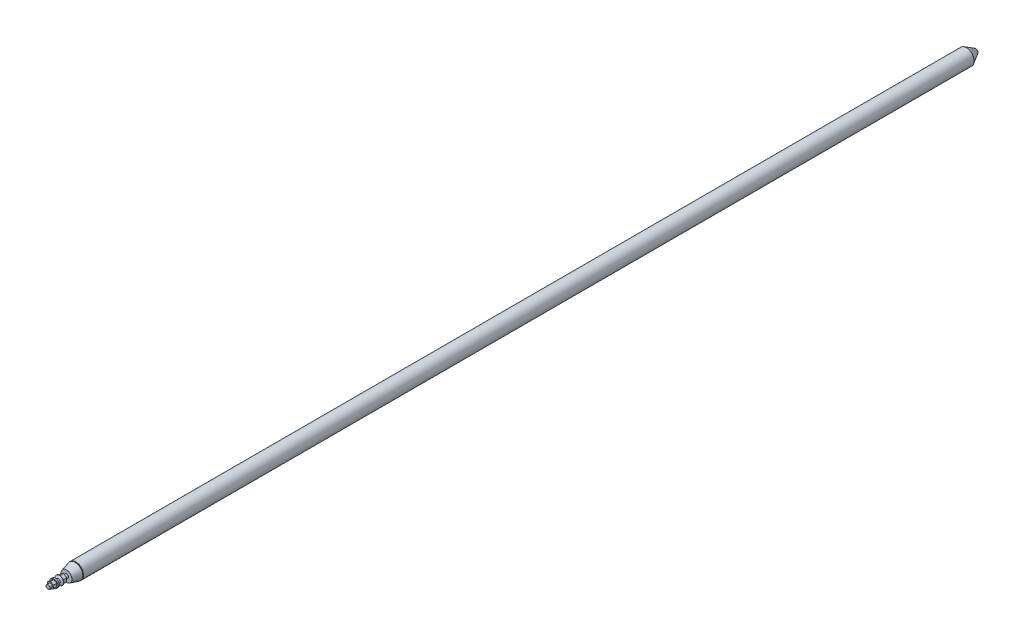
from build123d import *

# Parameters (mm, degrees)
BOSS_REVOLVE3_START         = 12.690475
BOSS_REVOLVE3_OUTLINE_R     = 7.9375
BOSS_REVOLVE3_DEPTH         = 15.478125
BOSS_REVOLVE3_START_2       = 46.292398399
BOSS_REVOLVE3_2_OUTLINE_R   = 16.6751
BOSS_REVOLVE3_2_OUTLINE_R_2 = 7.9375
BOSS_REVOLVE3_2_DEPTH       = 5.8166
BOSS_EXTRUDE2_DEPTH         = 13.890625


# Read off the part's stored shape, not the designer's step: Boss-Revolve3
with BuildPart() as part:
    # Sketch1 → Base-Revolve (revolve)
    with BuildSketch(Plane(origin=(0, 0, 0), x_dir=(0, 0, -1), z_dir=(1, 0, 0)), mode=Mode.PRIVATE) as base_revolve_sk:
        Polygon((-76.2, 0), (-76.2, 7.9375), (0, 7.9375), (0, 22.225), (34.895210283, 31.75), (38.1, 28.575), (47.625, 28.575), (47.625, 0), align=None)
    revolve(base_revolve_sk.sketch.rotate(Axis((0, 0, 0), (0, 0, 1)), 90), axis=Axis((0, 0, 0), (0, 0, 1)))

    # Sketch3 → Boss-Revolve2 (revolve)
    with BuildSketch(Plane(origin=(0, 0, 0), x_dir=(0, 0, -1), z_dir=(1, 0, 0)), mode=Mode.PRIVATE) as boss_revolve2_sk:
        with BuildLine():
            Line((-28.1686, 0), (-28.1686, 17.4625))
            Line((-28.1686, 17.4625), (-29.7688, 17.4625))
            ThreePointArc((-29.7688, 17.4625), (-33.309963658, 9.048473715), (-34.5186, 0))
            Line((-34.5186, 0), (-28.1686, 0))
        make_face()
    revolve(boss_revolve2_sk.sketch.rotate(Axis((0, 0, 0), (0, 0, 1)), 90), axis=Axis((0, 0, 0), (0, 0, 1)))

    # Sketch2 → Boss-Revolve1 (revolve)
    with BuildSketch(Plane(origin=(0, 0, 0), x_dir=(0, 0, -1), z_dir=(1, 0, 0)), mode=Mode.PRIVATE) as boss_revolve1_sk:
        with BuildLine():
            Line((38.1, 31.75), (38.1, 28.5623))
            Line((38.1, 28.5623), (3688.581247583, 28.5623))
            Line((3688.581247583, 28.5623), (3688.581247583, 0))
            Line((3688.581247583, 0), (3730.873860723, 0))
            ThreePointArc((3730.873860723, 0), (3729.172383351, 6.35), (3724.523860723, 10.998522628))
            Line((3724.523860723, 10.998522628), (3688.581247583, 31.75))
            Line((3688.581247583, 31.75), (38.1, 31.75))
        make_face()
    revolve(boss_revolve1_sk.sketch.rotate(Axis((0, 0, 29.7434), (0, 0, -1)), 90), axis=Axis((0, 0, 29.7434), (0, 0, -1)))

    # Boss-Revolve3 outline → Boss-Revolve3 (add)
    with BuildSketch(Plane.XY.offset(BOSS_REVOLVE3_START)):
        Polygon((0, -15.588572738), (13.5001, -7.794286369), (13.5001, 7.794286369), (0, 15.588572738), (-13.5001, 7.794286369), (-13.5001, -7.794286369), align=None)
        Circle(BOSS_REVOLVE3_OUTLINE_R, mode=Mode.SUBTRACT)
    extrude(amount=BOSS_REVOLVE3_DEPTH)

    # Boss-Revolve3 2 outline → Boss-Revolve3 2 (add)
    with BuildSketch(Plane.XY.offset(BOSS_REVOLVE3_START_2)):
        Circle(BOSS_REVOLVE3_2_OUTLINE_R)
        Circle(BOSS_REVOLVE3_2_OUTLINE_R_2, mode=Mode.SUBTRACT)
    extrude(amount=BOSS_REVOLVE3_2_DEPTH)

    # Sketch6 → Boss-Extrude2 (add)
    with BuildSketch(Plane.XY.offset(52.108998399)):
        Polygon((0, -13.755485633), (11.9126, -6.877742817), (11.9126, 6.877742817), (0, 13.755485633), (-11.9126, 6.877742817), (-11.9126, -6.877742817), align=None)
    extrude(amount=BOSS_EXTRUDE2_DEPTH)


solid = part.part
